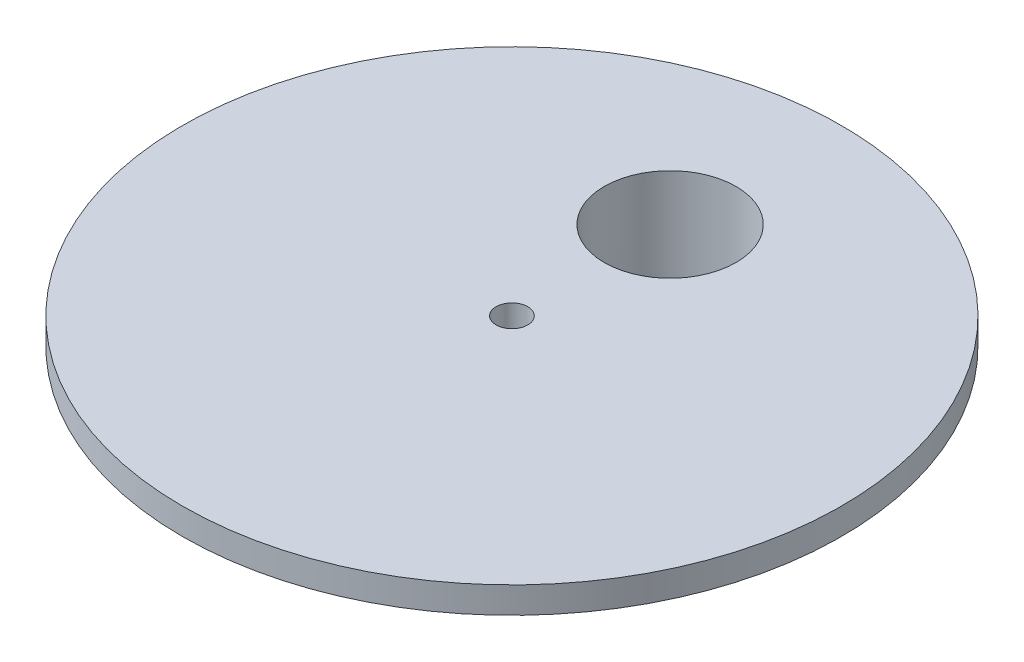
from build123d import *

# Parameters (mm, degrees)
SKETCH1_R           = 125
SKETCH1_R_2         = 25
SKETCH1_R_3         = 6
BOSS_EXTRUDE1_DEPTH = 10
BOSS_EXTRUDE2_START = 50
SKETCH2_R           = 30
SKETCH2_R_2         = 25
BOSS_EXTRUDE2_DEPTH = 50


with BuildPart() as part:
    # Sketch1 → Boss-Extrude1 (new body)
    with BuildSketch(Plane(origin=(0, 0, 0), x_dir=(1, 0, 0), z_dir=(0, 1, 0))):
        Circle(SKETCH1_R)
        with Locations((0, 60)):
            Circle(SKETCH1_R_2, mode=Mode.SUBTRACT)
        Circle(SKETCH1_R_3, mode=Mode.SUBTRACT)
    extrude(amount=BOSS_EXTRUDE1_DEPTH)

    # Sketch2 → Boss-Extrude2 (add)
    with BuildSketch(Plane.XZ.offset(BOSS_EXTRUDE2_START)):
        with Locations((0, -60)):
            Circle(SKETCH2_R)
        with Locations((0, -60)):
            Circle(SKETCH2_R_2, mode=Mode.SUBTRACT)
    extrude(amount=-BOSS_EXTRUDE2_DEPTH)


solid = part.part
